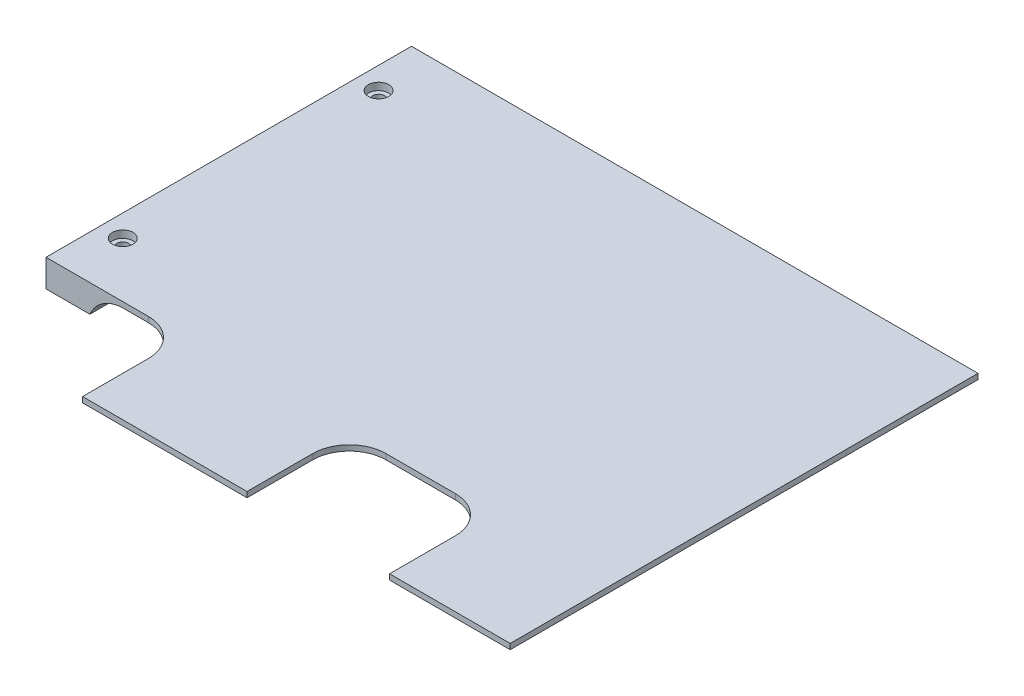
from build123d import *

# Parameters (mm, degrees)
CROQUIS1_W              = 155
CROQUIS1_H              = 100
SALIENTE_EXTRUIR1_DEPTH = 1.5
CROQUIS2_R              = 1.6
CORTAR_EXTRUIR1_DEPTH   = 1.5
CROQUIS3_W              = 12
CROQUIS3_H              = 100
CROQUIS3_R              = 1.6
SALIENTE_EXTRUIR2_DEPTH = 6
CROQUIS4_W              = 45
CROQUIS4_H              = 28
CROQUIS4_W_2            = 33
SALIENTE_EXTRUIR3_DEPTH = 1.5
REDONDEO1_R             = 10
REDONDEO2_R             = 10
CROQUIS5_R              = 2.8
CORTAR_EXTRUIR2_DEPTH   = 2


with BuildPart() as part:
    # Croquis1 → Saliente-Extruir1 (new body)
    with BuildSketch(Plane(origin=(0, 0, 0), x_dir=(1, 0, 0), z_dir=(0, 1, 0))):
        with Locations((77.5, 50)):
            Rectangle(CROQUIS1_W, CROQUIS1_H)
    extrude(amount=SALIENTE_EXTRUIR1_DEPTH)

    # Croquis2 → Cortar-Extruir1 (cut)
    with BuildSketch(Plane(origin=(0, 1.5, 0), x_dir=(1, 0, 0), z_dir=(0, 1, 0))):
        with Locations(Location((6, 85, 0), (0, 0, 270))):
            Circle(CROQUIS2_R)
        with Locations(Location((6, 15, 0), (0, 0, 270))):
            Circle(CROQUIS2_R)
    extrude(amount=-CORTAR_EXTRUIR1_DEPTH, mode=Mode.SUBTRACT)

    # Croquis3 → Saliente-Extruir2 (add)
    with BuildSketch(Plane.XZ):
        with Locations((6, -50)):
            Rectangle(CROQUIS3_W, CROQUIS3_H)
        with Locations(Location((6, -15, 0), (0, 0, 90))):
            Circle(CROQUIS3_R, mode=Mode.SUBTRACT)
        with Locations(Location((6, -85, 0), (0, 0, 90))):
            Circle(CROQUIS3_R, mode=Mode.SUBTRACT)
    extrude(amount=SALIENTE_EXTRUIR2_DEPTH)

    # Croquis4 → Saliente-Extruir3 (add)
    with BuildSketch(Plane(origin=(0, 1.5, 0), x_dir=(1, 0, 0), z_dir=(0, 1, 0))):
        with Locations((60.5, -14)):
            Rectangle(CROQUIS4_W, CROQUIS4_H)
        with Locations((138.5, -14)):
            Rectangle(CROQUIS4_W_2, CROQUIS4_H)
    extrude(amount=-SALIENTE_EXTRUIR3_DEPTH)

    # Redondeo1
    redondeo1_edges = [part.edges().sort_by_distance(p)[0] for p in [
        (83, 0.75, 0),
        (38, 0.75, 0),
        (122, 0.75, 0),
    ]]
    fillet(redondeo1_edges, radius=REDONDEO1_R)

    # Redondeo2
    # the kernel refuses this fillet: 10 mm, written as the material it adds along each edge
    with BuildSketch(Plane(origin=(12, 0, -100), x_dir=(0, -1, 0), z_dir=(0, 0, 1))) as redondeo2_piece_1:
        with BuildLine():
            CenterArc((10, 9.16515139), REDONDEO2_R, 180, 66.421821522)
            Line((0, 9.16515139), (-0.2, 9.16515139))
            Line((-0.2, 9.16515139), (-0.2, 0))
            Line((-0.2, 0), (0, -0.2))
            ThreePointArc((0, -0.2), (3, -0.2), (5.92, -0.183303028))
            Line((5.92, -0.183303028), (6, 0))
        make_face()
    extrude(amount=100)

    # Croquis5 → Cortar-Extruir2 (cut)
    with BuildSketch(Plane(origin=(0, 1.5, 0), x_dir=(1, 0, 0), z_dir=(0, 1, 0))):
        with Locations(Location((6, 85, 0), (0, 0, 270))):
            Circle(CROQUIS5_R)
        with Locations(Location((6, 15, 0), (0, 0, 270))):
            Circle(CROQUIS5_R)
    extrude(amount=-CORTAR_EXTRUIR2_DEPTH, mode=Mode.SUBTRACT)


solid = part.part
